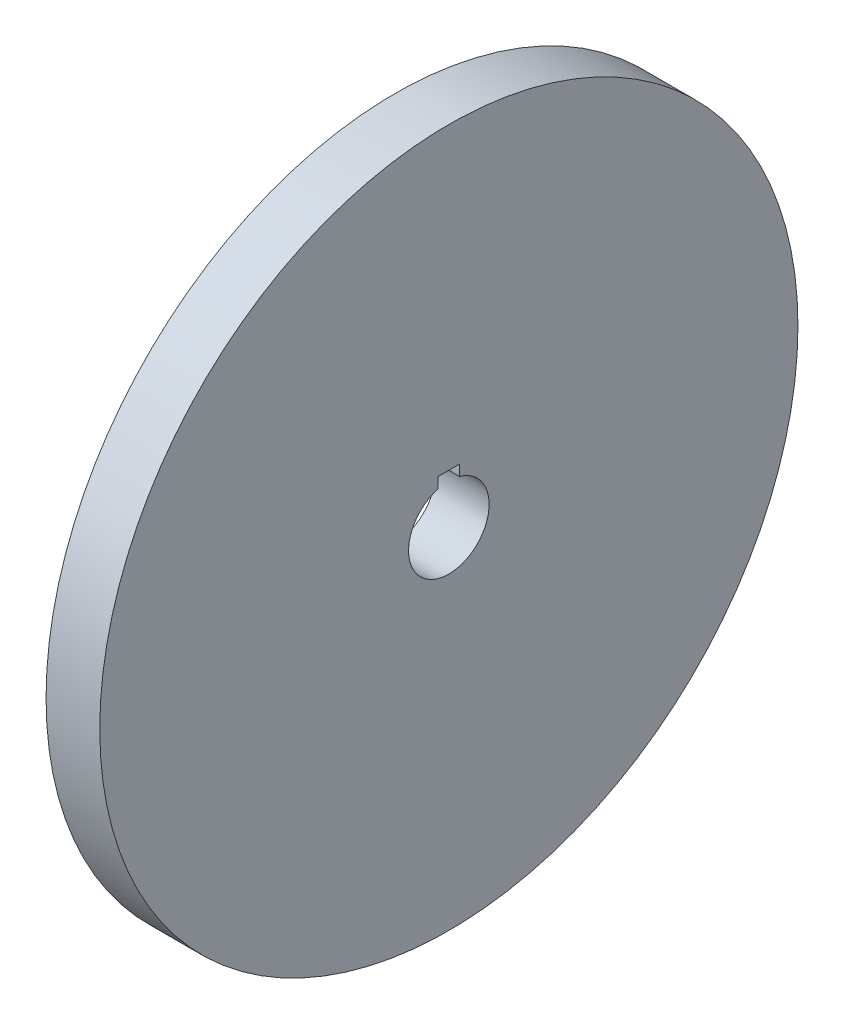
from build123d import *

# Parameters (mm, degrees)
SKETCH1_R           = 65
BOSS_EXTRUDE1_DEPTH = 5
SKETCH4_R           = 7.5
CUT_EXTRUDE3_DEPTH  = 93.466210045
CUT_EXTRUDE4_DEPTH  = 93.466210045


with BuildPart() as part:
    # Sketch1 → Boss-Extrude1 (new, symmetric)
    with BuildSketch(Plane(origin=(0, 0, 0), x_dir=(0, 0, -1), z_dir=(1, 0, 0))):
        Circle(SKETCH1_R)
    extrude(amount=BOSS_EXTRUDE1_DEPTH, both=True)

    # Sketch4 → Cut-Extrude3 (cut, through all)
    with BuildSketch(Plane(origin=(5, 0, 0), x_dir=(0, 0, -1), z_dir=(1, 0, 0))):
        Circle(SKETCH4_R)
    extrude(amount=-CUT_EXTRUDE3_DEPTH, mode=Mode.SUBTRACT)

    # Sketch6 → Cut-Extrude4 (cut, through all)
    with BuildSketch(Plane(origin=(5, 0, 0), x_dir=(0, 0, -1), z_dir=(1, 0, 0))):
        with BuildLine():
            Line((2, 9.228416147), (-2, 9.228416147))
            Line((-2, 9.228416147), (-2, 7.228416147))
            ThreePointArc((-2, 7.228416147), (0, 7.5), (2, 7.228416147))
            Line((2, 7.228416147), (2, 9.228416147))
        make_face()
    extrude(amount=-CUT_EXTRUDE4_DEPTH, mode=Mode.SUBTRACT)


solid = part.part
